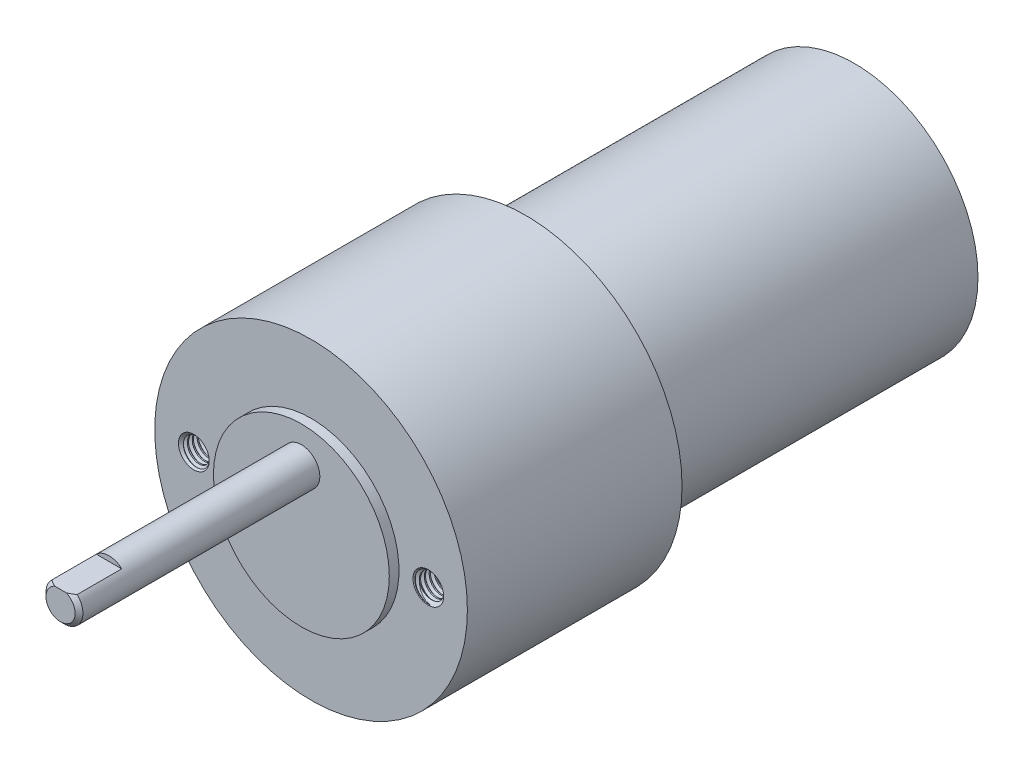
from build123d import *

# Parameters (mm, degrees)
SKETCH1_R          = 14.2875
EXTRUDE1_DEPTH     = 1.5748
SKETCH2_R          = 20.066
EXTRUDE2_DEPTH     = 88.2904
SKETCH3_R          = 3
EXTRUDE3_DEPTH     = 40.7
SKETCH4_W          = 4.118553844
SKETCH4_H          = 0.8184
CUT_EXTRUDE1_DEPTH = 7.874
SKETCH5_W          = 34.8742
SKETCH5_H          = 5.334
CHAMFER1_SIZE      = 0.635
SKETCH10_R         = 2.413
CUT_EXTRUDE3_DEPTH = 6.35
SWEEP1_PITCH       = 0.79375
CIRPATTERN1_COUNT  = 2


# Read off the part's stored shape, not the designer's step: Cut-Extrude4
with BuildPart() as part:
    # Sketch1 → Extrude1 (new body)
    with BuildSketch(Plane.XY):
        Circle(SKETCH1_R)
    extrude(amount=EXTRUDE1_DEPTH)

    # Sketch2 → Extrude2 (add)
    with BuildSketch(Plane(origin=(0, 0, 0), x_dir=(-1, 0, 0), z_dir=(0, 0, -1))):
        with Locations(Location((0, 0, 0), (0, 0, 180))):
            Circle(SKETCH2_R)
    extrude(amount=EXTRUDE2_DEPTH)

    # Sketch3 → Extrude3 (add)
    with BuildSketch(Plane.XY):
        with Locations((0, 8.3566)):
            Circle(SKETCH3_R)
    extrude(amount=EXTRUDE3_DEPTH)

    # Sketch4 → Cut-Extrude1 (cut)
    with BuildSketch(Plane.XY.offset(40.7)):
        with Locations((0, 10.9474)):
            Rectangle(SKETCH4_W, SKETCH4_H)
    extrude(amount=-CUT_EXTRUDE1_DEPTH, mode=Mode.SUBTRACT)

    # Sketch5 → Revolve1 (revolve)
    with BuildSketch(Plane(origin=(0, 0, 0), x_dir=(0, 0, -1), z_dir=(1, 0, 0)), mode=Mode.PRIVATE) as revolve1_sk:
        with Locations((17.4371, 22.733)):
            Rectangle(SKETCH5_W, SKETCH5_H)
    revolve(revolve1_sk.sketch.rotate(Axis((0, 0, 4.819894785), (0, 0, -1)), 90), axis=Axis((0, 0, 4.819894785), (0, 0, -1)))

    # Sketch6 → Revolve2 (revolve)
    with BuildSketch(Plane(origin=(0, 0, 0), x_dir=(0, 0, -1), z_dir=(1, 0, 0)), mode=Mode.PRIVATE) as revolve2_sk:
        Polygon((88.2904, 0), (88.2904, 6.35), (89.8652, 6.35), (89.8652, 1.98247), (91.1352, 1.98247), (91.1352, 0), align=None)
    revolve(revolve2_sk.sketch.rotate(Axis((0, 0, -51.186992867), (0, 0, -1)), 90), axis=Axis((0, 0, -51.186992867), (0, 0, -1)))

    # Chamfer1
    chamfer1_edges = [part.edges().sort_by_distance(p)[0] for p in [
        (-1.187890827, 5.60180139, 40.7),
        (-1.98247, 0, -91.1352),
    ]]
    chamfer(chamfer1_edges, length=CHAMFER1_SIZE)

    # Sketch10 → Cut-Extrude3 (cut)
    with BuildSketch(Plane.XY):
        with Locations((-19.05, 0)):
            Circle(SKETCH10_R)
    cut_extrude3 = extrude(amount=-CUT_EXTRUDE3_DEPTH, mode=Mode.SUBTRACT)

    # Sweep1: the profile of Sketch12 screwed along a right-hand helix of 9 turns, 8 arcs to a turn; built about Z, then put on its axis
    sweep1_z = Axis((0, 0, 0), (0, 0, 1))
    sweep1_corners = [(2.455962979, 0, -0.719335937), (1.98337021, 0, -0.446484375), (1.98337021, 0, -0.248046875), (2.455962979, 0, 0.024804687)]
    with BuildLine(mode=Mode.PRIVATE) as sweep1_profile:
        Line(sweep1_corners[0], sweep1_corners[1])
        Line(sweep1_corners[1], sweep1_corners[2])
        Line(sweep1_corners[2], sweep1_corners[3])
        Line(sweep1_corners[3], sweep1_corners[0])
    sweep1_cap = Face(sweep1_profile.wire())
    sweep1_turn_angles = [0, 22.5, 45, 67.5, 90, 112.5, 135, 157.5, 180, 202.5, 225, 247.5, 270, 292.5, 315, 337.5, 360]
    sweep1_turn_weights = [1, 0.9238795325112867, 1, 0.9238795325112867, 1, 0.9238795325112867, 1, 0.9238795325112867, 1, 0.9238795325112867, 1, 0.9238795325112867, 1, 0.9238795325112867, 1, 0.9238795325112867, 1]
    sweep1_turn_rails = [Edge.make_bspline([Vector(p[0], p[1], 0).rotate(sweep1_z, sweep1_turn_angles[k]) / sweep1_turn_weights[k] + Vector(0, 0, p[2] + SWEEP1_PITCH * sweep1_turn_angles[k] / 360) for k in range(17)], [0, 0, 0, 1, 1, 2, 2, 3, 3, 4, 4, 5, 5, 6, 6, 7, 7, 8, 8, 8], 2, sweep1_turn_weights) for p in sweep1_corners]
    sweep1_turn_sides = [Face.make_surface_from_curves(sweep1_turn_rails[p[0]], sweep1_turn_rails[p[1]]) for p in [(0, 1), (1, 2), (2, 3), (3, 0)]]
    sweep1 = Plane(origin=(-19.05, 0, 0), x_dir=(0, 1, 0), z_dir=(0, 0, -1)) * Solid(Shell([*[p.moved(Location((0, 0, SWEEP1_PITCH * i))) for i in range(9) for p in sweep1_turn_sides], sweep1_cap, sweep1_cap.rotate(sweep1_z, 3240).moved(Location((0, 0, SWEEP1_PITCH * 3240 / 360)))]))
    add(sweep1)

    # Cut-Extrude4 outline → Cut-Extrude4 (revolve, cut)
    with BuildSketch(Plane(origin=(-19.05, 0, 0), x_dir=(1, 0, 0), z_dir=(0, -1, 0))):
        Polygon((1.983365303, -0.515560655), (2.498925958, 0), (2.498925958, 0.719336037), (1.983365303, 0.719336037), align=None)
    cut_extrude4 = revolve(axis=Axis((-19.05, 0, 0), (0, 0, 1)), mode=Mode.SUBTRACT)

    # CirPattern1: Cut-Extrude3, Sweep1, Cut-Extrude4 ×2 about axis
    cirpattern1_axis = Axis((0, 0, -88.2904), (0, 0, 1))
    add([cut_extrude3.rotate(cirpattern1_axis, i * 360 / CIRPATTERN1_COUNT) for i in range(1, CIRPATTERN1_COUNT)], mode=Mode.SUBTRACT)
    add([sweep1.rotate(cirpattern1_axis, i * 360 / CIRPATTERN1_COUNT) for i in range(1, CIRPATTERN1_COUNT)])
    add([cut_extrude4.rotate(cirpattern1_axis, i * 360 / CIRPATTERN1_COUNT) for i in range(1, CIRPATTERN1_COUNT)], mode=Mode.SUBTRACT)


solid = part.part
